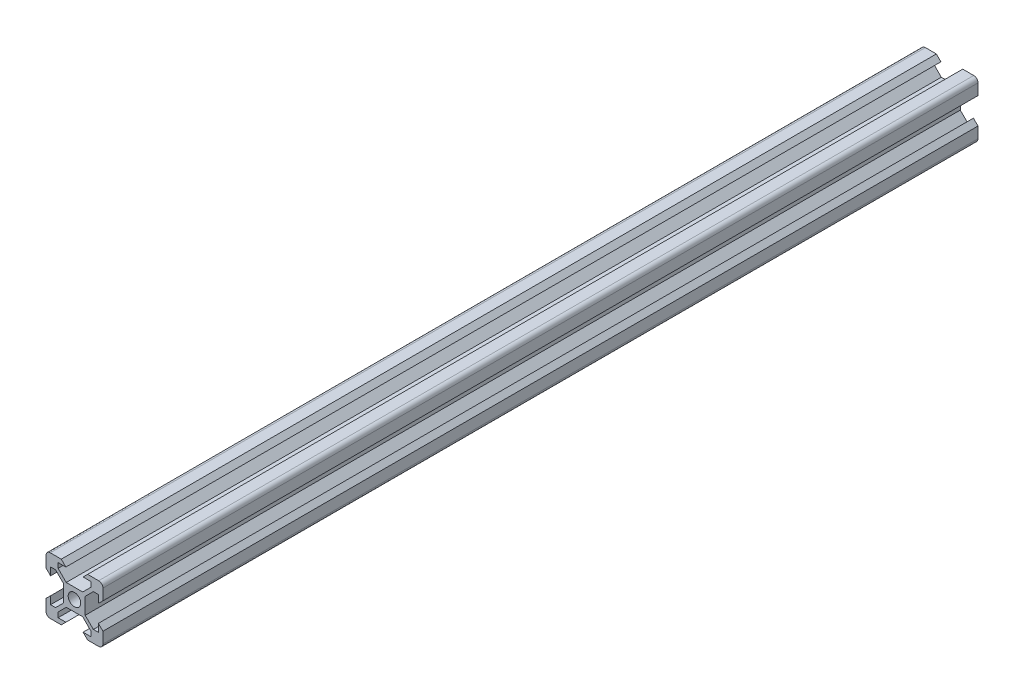
from build123d import *

# Parameters (mm, degrees)
SKETCH1_R           = 4.4
BOSS_EXTRUDE1_DEPTH = 307.5


with BuildPart() as part:
    # Sketch1 → Boss-Extrude1 (new, symmetric)
    with BuildSketch(Plane.XY):
        with BuildLine():
            Line((-13.271281672, 11.512), (-7.544, 5.784718328))
            Line((-7.544, 5.784718328), (-7.544, -5.784718328))
            Line((-7.544, -5.784718328), (-13.271281672, -11.512))
            Line((-13.271281672, -11.512), (-16.8, -11.512))
            Line((-16.8, -11.512), (-16.8, -6.051976926))
            Line((-16.8, -6.051976926), (-20, -9.251976926))
            Line((-20, -9.251976926), (-20, -17))
            ThreePointArc((-20, -17), (-19.121320344, -19.121320344), (-17, -20))
            Line((-17, -20), (-9.251976926, -20))
            Line((-9.251976926, -20), (-6.051976926, -16.8))
            Line((-6.051976926, -16.8), (-11.512, -16.8))
            Line((-11.512, -16.8), (-11.512, -13.271281672))
            Line((-11.512, -13.271281672), (-5.784718328, -7.544))
            Line((-5.784718328, -7.544), (5.784718328, -7.544))
            Line((5.784718328, -7.544), (11.512, -13.271281672))
            Line((11.512, -13.271281672), (11.512, -16.8))
            Line((11.512, -16.8), (6.051976926, -16.8))
            Line((6.051976926, -16.8), (9.251976926, -20))
            Line((9.251976926, -20), (17, -20))
            ThreePointArc((17, -20), (19.121320344, -19.121320344), (20, -17))
            Line((20, -17), (20, -9.251976926))
            Line((20, -9.251976926), (16.8, -6.051976926))
            Line((16.8, -6.051976926), (16.8, -11.512))
            Line((16.8, -11.512), (13.271281672, -11.512))
            Line((13.271281672, -11.512), (7.544, -5.784718328))
            Line((7.544, -5.784718328), (7.544, 5.784718328))
            Line((7.544, 5.784718328), (13.271281672, 11.512))
            Line((13.271281672, 11.512), (16.8, 11.512))
            Line((16.8, 11.512), (16.8, 6.051976926))
            Line((16.8, 6.051976926), (20, 9.251976926))
            Line((20, 9.251976926), (20, 17))
            ThreePointArc((20, 17), (19.121320344, 19.121320344), (17, 20))
            Line((17, 20), (9.251976926, 20))
            Line((9.251976926, 20), (6.051976926, 16.8))
            Line((6.051976926, 16.8), (11.512, 16.8))
            Line((11.512, 16.8), (11.512, 13.271281672))
            Line((11.512, 13.271281672), (5.784718328, 7.544))
            Line((5.784718328, 7.544), (-5.784718328, 7.544))
            Line((-5.784718328, 7.544), (-11.512, 13.271281672))
            Line((-11.512, 13.271281672), (-11.512, 16.8))
            Line((-11.512, 16.8), (-6.051976926, 16.8))
            Line((-6.051976926, 16.8), (-9.251976926, 20))
            Line((-9.251976926, 20), (-17, 20))
            ThreePointArc((-17, 20), (-19.121320344, 19.121320344), (-20, 17))
            Line((-20, 17), (-20, 9.251976926))
            Line((-20, 9.251976926), (-16.8, 6.051976926))
            Line((-16.8, 6.051976926), (-16.8, 11.512))
            Line((-16.8, 11.512), (-13.271281672, 11.512))
        make_face()
        Circle(SKETCH1_R, mode=Mode.SUBTRACT)
    extrude(amount=BOSS_EXTRUDE1_DEPTH, both=True)


solid = part.part
